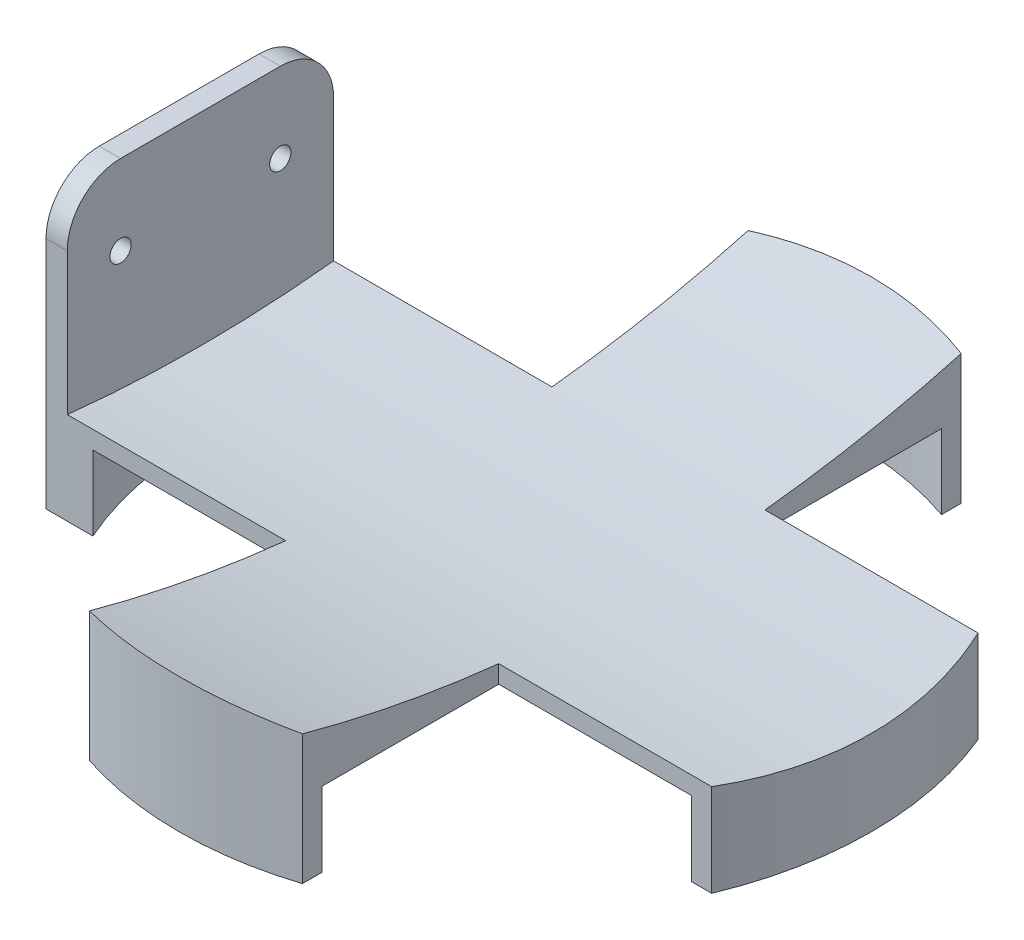
from build123d import *

# Parameters (mm, degrees)
SKETCH_1_W           = 50
SKETCH_1_H           = 40
EXTRUDE_1_DEPTH      = 4
SKETCH_2_R           = 2
CUT_EXTRUDE_1_DEPTH  = 4
EXTRUDE_2_DEPTH      = 180
CUT_EXTRUDE_START    = -60
CUT_EXTRUDE_2_DEPTH  = 60
CUT_EXTRUDE_3_DEPTH  = 60
EXTRUDE_3_REACH      = 191.95
EXTRUDE_3_END_RADIUS = 233
EXTRUDE_START        = 14
EXTRUDE_4_DEPTH      = 14
CUT_EXTRUDE_4_DEPTH  = 203.477159329
EXTRUDE_6_REACH      = 157.052
EXTRUDE_7_REACH      = 157.052
FILLET_1_R           = 10


with BuildPart() as part:
    # 草图1 → 凸台-拉伸1 (new body)
    with BuildSketch(Plane(origin=(0, 0, 0), x_dir=(0, 0, -1), z_dir=(1, 0, 0))):
        with Locations((0, -20)):
            Rectangle(SKETCH_1_W, SKETCH_1_H)
    extrude(amount=EXTRUDE_1_DEPTH)

    # 草图2 → 切除-拉伸1 (cut)
    with BuildSketch(Plane(origin=(4, 0, 0), x_dir=(0, 0, -1), z_dir=(1, 0, 0))):
        with Locations((-15, -15)):
            Circle(SKETCH_2_R)
        with Locations((15, -15)):
            Circle(SKETCH_2_R)
    extrude(amount=-CUT_EXTRUDE_1_DEPTH, mode=Mode.SUBTRACT)

    # 草图3 → 凸台-拉伸2 (add)
    with BuildSketch(Plane(origin=(4, 0, 0), x_dir=(0, 0, -1), z_dir=(1, 0, 0))):
        with BuildLine():
            Line((-25, -36.654915769), (-25, -38.666428911))
            ThreePointArc((-25, -38.666428911), (0, -40), (25, -38.666428911))
            Line((25, -38.666428911), (25, -36.654915769))
            ThreePointArc((25, -36.654915769), (0, -38), (-25, -36.654915769))
        make_face()
    extrude(amount=EXTRUDE_2_DEPTH)

    # 草图4 → 切除-拉伸2 (cut)
    with BuildSketch(Plane(origin=(4, 0, 0), x_dir=(0, 0, -1), z_dir=(1, 0, 0)).offset(CUT_EXTRUDE_START)):
        with BuildLine():
            ThreePointArc((25, -38.666428911), (12.517771485, -39.666370401), (0, -40))
            Line((0, -40), (25, -40))
            Line((25, -40), (25, -38.666428911))
        make_face()
    extrude(amount=CUT_EXTRUDE_2_DEPTH, mode=Mode.SUBTRACT)

    # 草图5 → 切除-拉伸3 (cut)
    with BuildSketch(Plane(origin=(4, 0, 0), x_dir=(0, 0, -1), z_dir=(1, 0, 0)).offset(CUT_EXTRUDE_START)):
        with BuildLine():
            Line((-25, -38.666428911), (-25, -40))
            Line((-25, -40), (0, -40))
            ThreePointArc((0, -40), (-12.517771485, -39.666370401), (-25, -38.666428911))
        make_face()
    extrude(amount=CUT_EXTRUDE_3_DEPTH, mode=Mode.SUBTRACT)

    # 凸台-拉伸3: up to this cylinder (the profile starts outside it)
    extrude_3_end = Plane(origin=(65.000728, 195, 0), z_dir=(-1, 0, 0)) * Cylinder(EXTRUDE_3_END_RADIUS, 850.9, mode=Mode.PRIVATE)
    # 草图6 → 凸台-拉伸3 (add, up to the surface)
    with BuildSketch(Plane(origin=(0, -40, 0), x_dir=(-1, 0, 0), z_dir=(0, -1, 0)), mode=Mode.PRIVATE) as extrude_3_sk1:
        with BuildLine():
            Line((-85.002334196, 61.845829501), (-85.002334196, 25))
            Line((-85.002334196, 25), (-125, 25))
            ThreePointArc((-125, 25), (-130, 0), (-125, -25))
            Line((-125, -25), (-85.002334196, -25))
            Line((-85.002334196, -25), (-85.002334196, -61.845829501))
            ThreePointArc((-85.002334196, -61.845829501), (-65.002453212, -64.999999954), (-45.002334196, -61.84733917))
            Line((-45.002334196, -61.84733917), (-45.002334196, -25))
            Line((-45.002334196, -25), (-5, -25))
            ThreePointArc((-5, -25), (0, 0), (-5, 25))
            Line((-5, 25), (-45.002334196, 25))
            Line((-45.002334196, 25), (-45.002334196, 61.84733917))
            ThreePointArc((-45.002334196, 61.84733917), (-65.002453212, 64.999999954), (-85.002334196, 61.845829501))
        make_face()
    extrude_3_tool1 = extrude(extrude_3_sk1.sketch, amount=-EXTRUDE_3_REACH, mode=Mode.PRIVATE) - extrude_3_end
    extrude_3 = extrude_3_tool1.solids().sort_by_distance((65.000728, -40, 0))[0]
    add(extrude_3)

    # 镜向1: 凸台-拉伸3 across plane
    add(extrude_3.mirror(Plane.XY))

    # 草图7 → 凸台-拉伸4 (add)
    with BuildSketch(Plane.XZ.offset(40).offset(EXTRUDE_START)):
        with BuildLine():
            Line((5, -25), (8.810588186, -25))
            ThreePointArc((8.810588186, -25), (3.5, 0), (8.810588186, 25))
            Line((8.810588186, 25), (5, 25))
            ThreePointArc((5, 25), (1.26225608, 12.747548784), (0, 0))
            ThreePointArc((0, 0), (1.26225608, -12.747548784), (5, -25))
        make_face()
        with BuildLine():
            Line((45.002334196, -58.157917452), (45.002334196, -61.84733917))
            ThreePointArc((45.002334196, -61.84733917), (65.002453212, -64.999999954), (85.002334196, -61.845829501))
            Line((85.002334196, -61.845829501), (85.002334196, -58.156312011))
            ThreePointArc((85.002334196, -58.156312011), (65.002468367, -61.49999995), (45.002334196, -58.157917452))
        make_face()
        with BuildLine():
            Line((121.189411814, -25), (125, -25))
            ThreePointArc((125, -25), (128.73774392, -12.747548784), (130, 0))
            ThreePointArc((130, 0), (128.73774392, 12.747548784), (125, 25))
            Line((125, 25), (121.189411814, 25))
            ThreePointArc((121.189411814, 25), (126.5, 0), (121.189411814, -25))
        make_face()
        with BuildLine():
            Line((85.002334196, 58.156312011), (85.002334196, 61.845829501))
            ThreePointArc((85.002334196, 61.845829501), (65.002453212, 64.999999954), (45.002334196, 61.84733917))
            Line((45.002334196, 61.84733917), (45.002334196, 58.157917452))
            ThreePointArc((45.002334196, 58.157917452), (65.002468367, 61.49999995), (85.002334196, 58.156312011))
        make_face()
    extrude(amount=-EXTRUDE_4_DEPTH)

    # 草图8 → 切除-拉伸4 (cut, through all)
    with BuildSketch(Plane.XZ.offset(54)):
        with BuildLine():
            Line((184, 25), (125, 25))
            ThreePointArc((125, 25), (130, 0), (125, -25))
            Line((125, -25), (184, -25))
            Line((184, -25), (184, 25))
        make_face()
    extrude(amount=-CUT_EXTRUDE_4_DEPTH, mode=Mode.SUBTRACT)

    # 草图11 → 凸台-拉伸6 (add, up to next)
    with BuildSketch(Plane.XZ.offset(54), mode=Mode.PRIVATE) as extrude_6_sk1:
        with BuildLine():
            Line((0, 25), (0, 0))
            ThreePointArc((0, 0), (1.26225608, 12.747548784), (5, 25))
            Line((5, 25), (0, 25))
        make_face()
    extrude_6_tool1 = extrude(extrude_6_sk1.sketch, amount=-EXTRUDE_6_REACH, mode=Mode.PRIVATE) - part.part
    add(extrude_6_tool1.solids().sort_by_distance((1.489564, -54, 18.799089))[0])

    # 草图12 → 凸台-拉伸7 (add, up to next)
    with BuildSketch(Plane.XZ.offset(54), mode=Mode.PRIVATE) as extrude_7_sk1:
        with BuildLine():
            Line((0, -25), (5, -25))
            ThreePointArc((5, -25), (1.26225608, -12.747548784), (0, 0))
            Line((0, 0), (0, -25))
        make_face()
    extrude_7_tool1 = extrude(extrude_7_sk1.sketch, amount=-EXTRUDE_7_REACH, mode=Mode.PRIVATE) - part.part
    add(extrude_7_tool1.solids().sort_by_distance((1.489564, -54, -18.799089))[0])

    # 圆角1
    fillet_1_edges = [part.edges().sort_by_distance(p)[0] for p in [
        (2, 0, 25),
        (2, 0, -25),
    ]]
    fillet(fillet_1_edges, radius=FILLET_1_R)


solid = part.part
